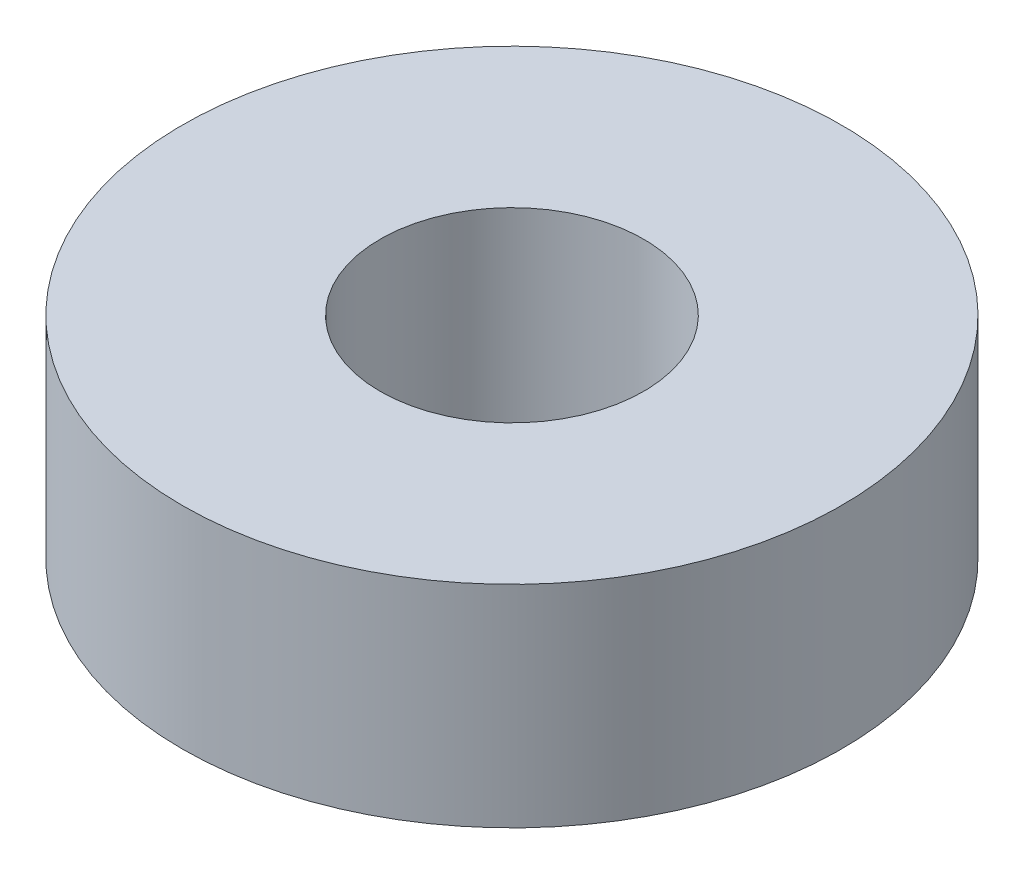
from build123d import *

# Parameters (mm, degrees)
SKETCH1_R           = 25
BOSS_EXTRUDE1_DEPTH = 16
SKETCH2_R           = 10
CUT_EXTRUDE1_DEPTH  = 39.807215824


with BuildPart() as part:
    # Sketch1 → Boss-Extrude1 (new body)
    with BuildSketch(Plane(origin=(0, 0, 0), x_dir=(1, 0, 0), z_dir=(0, 1, 0))):
        Circle(SKETCH1_R)
    extrude(amount=BOSS_EXTRUDE1_DEPTH)

    # Sketch2 → Cut-Extrude1 (cut, through all)
    with BuildSketch(Plane(origin=(0, 0, 0), x_dir=(1, 0, 0), z_dir=(0, 1, 0))):
        Circle(SKETCH2_R)
    extrude(amount=CUT_EXTRUDE1_DEPTH, mode=Mode.SUBTRACT)


solid = part.part
